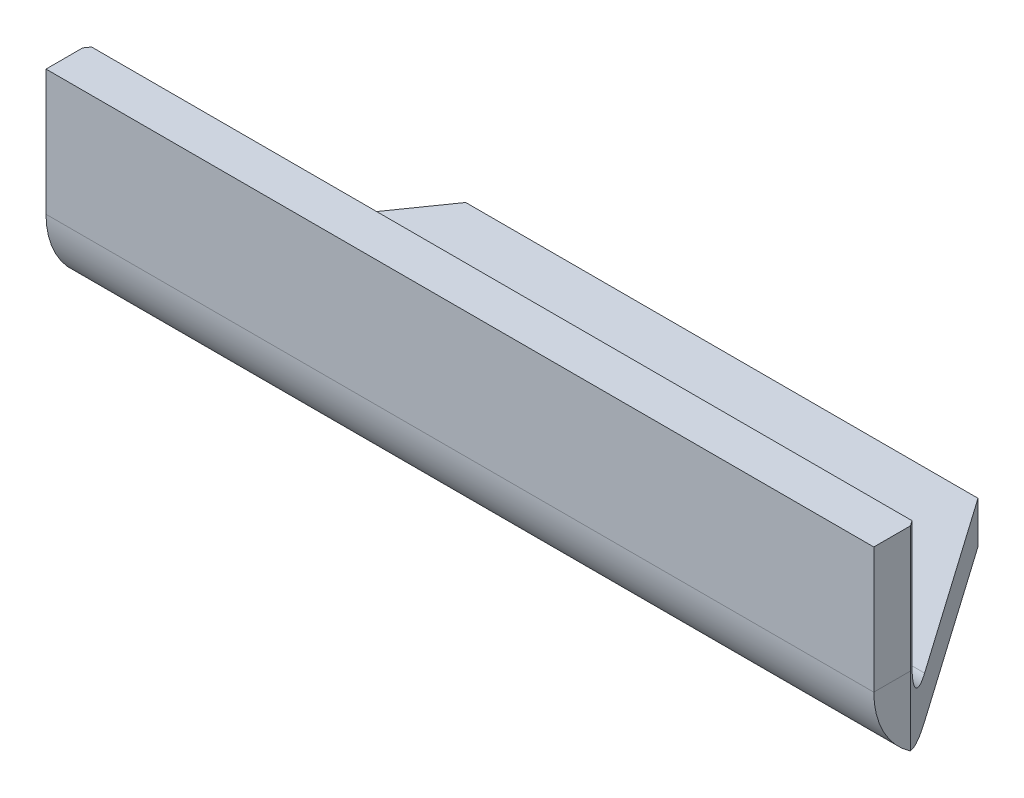
from build123d import *

# Parameters (mm, degrees)
SKETCH1_W                    = 158
SKETCH1_H                    = 50
BASE_FLANGE1_DEPTH           = 8
EDGE_FLANGE1_STRIP_W         = 48
EDGE_FLANGE1_STRIP_H         = 8
EDGE_FLANGE1_STRIP_CUT_DEPTH = 158
EDGE_FLANGE1_DEPTH           = 158
CHAMFER1_SIZE                = 43
CHAMFER1_SIZE2               = 30.108924143
MIRROR2_START                = 54.388635645
MIRROR2_OUTLINE_W            = 56
MIRROR2_OUTLINE_H            = 41
MIRROR2_DEPTH                = 24.663786763


# Read off the part's stored shape, not the designer's step: Mirror2
# Sheet-metal steps are written as plain solids
with BuildPart() as part:
    # Sketch1 → Base-Flange1 (new body)
    with BuildSketch(Plane(origin=(0, 0, 0), x_dir=(1, 0, 0), z_dir=(0, 1, 0))):
        Rectangle(SKETCH1_W, SKETCH1_H)
    extrude(amount=-BASE_FLANGE1_DEPTH)

    # Edge-Flange1 strip (across the edge) → Edge-Flange1 strip cut (cut)
    with BuildSketch(Plane(origin=(-79, 0, 25), x_dir=(0, 0, -1), z_dir=(1, 0, 0))):
        with Locations((-8, -4)):
            Rectangle(EDGE_FLANGE1_STRIP_W, EDGE_FLANGE1_STRIP_H)
    extrude(amount=EDGE_FLANGE1_STRIP_CUT_DEPTH, mode=Mode.SUBTRACT)

    # Edge-Flange1 section (across the edge) → Edge-Flange1 (add)
    with BuildSketch(Plane(origin=(-79, 0, 25), x_dir=(0, 0, -1), z_dir=(1, 0, 0))):
        with BuildLine():
            Line((0, 8), (0, 32))
            Line((0, 32), (8, 32))
            Line((8, 32), (8, 8))
            ThreePointArc((8, 8), (10.343145751, 2.343145751), (16, 0))
            Line((16, 0), (16, -8))
            ThreePointArc((16, -8), (4.686291501, -3.313708499), (0, 8))
        make_face()
    extrude(amount=EDGE_FLANGE1_DEPTH)

    # Chamfer1
    chamfer1_edges = [part.edges().sort_by_distance(p)[0] for p in [
        (-79, -4, -25),
    ]]
    chamfer1_side = [part.faces().sort_by_distance(p)[0] for p in [
        (-79, -0.640312424, -8),
    ]]
    chamfer(chamfer1_edges, length=CHAMFER1_SIZE, length2=CHAMFER1_SIZE2, reference=chamfer1_side[0])

    # Mirror2 outline → Mirror2 (cut)
    with BuildSketch(Plane(origin=(0, 0, 0), x_dir=(0.5735764363510512, 0, 0.8191520442889882), z_dir=(0.8191520442889882, 0, -0.5735764363510512)).offset(MIRROR2_START)):
        with Locations((34, -12.5)):
            Rectangle(MIRROR2_OUTLINE_W, MIRROR2_OUTLINE_H)
    extrude(amount=MIRROR2_DEPTH, mode=Mode.SUBTRACT)


solid = part.part
